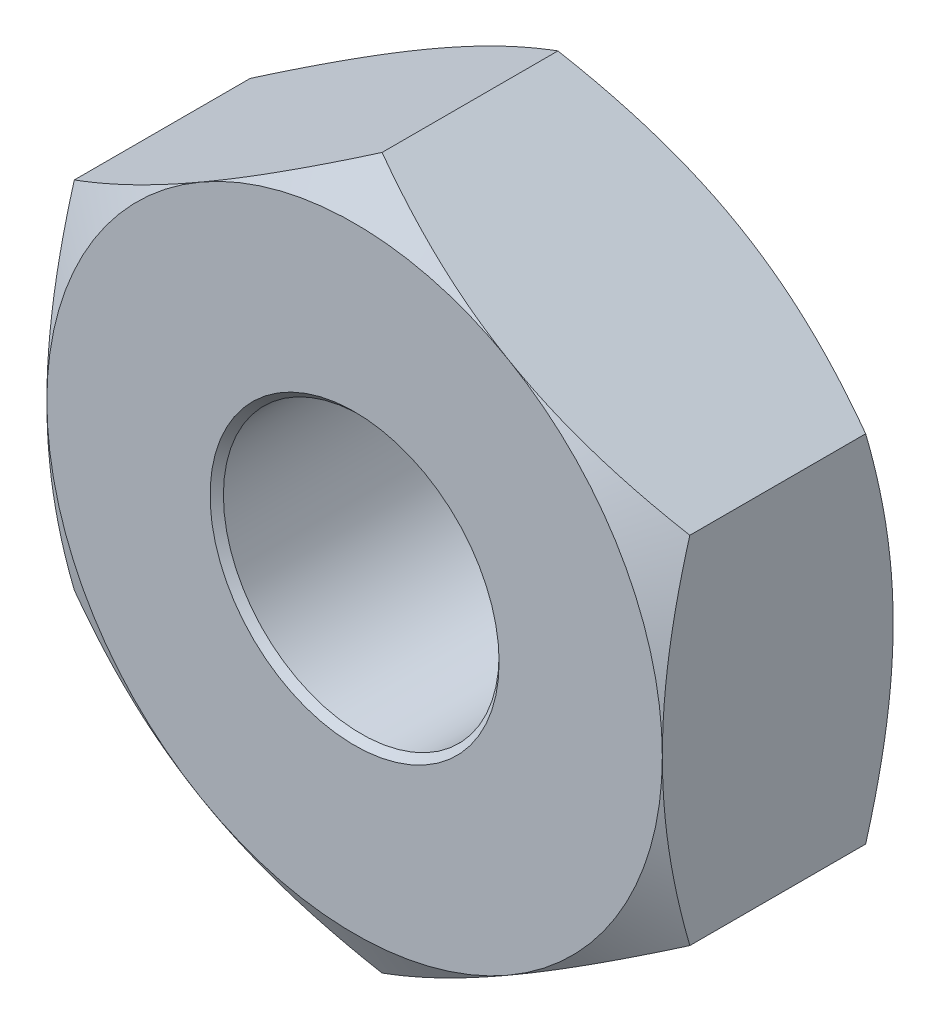
from build123d import *

# Parameters (mm, degrees)
BOSS_EXTRUDE1_START = -1.190625
SKETCH3_R           = 1.4224
BOSS_EXTRUDE1_DEPTH = 2.38125


# Read off the part's stored shape, not the designer's step: Cut-Revolve1
with BuildPart() as part:
    # Sketch3 → Boss-Extrude1 (new body)
    with BuildSketch(Plane.XY.offset(BOSS_EXTRUDE1_START)):
        Polygon((-3.175, 1.833087105), (-3.175, -1.833087105), (0, -3.666174209), (3.175, -1.833087105), (3.175, 1.833087105), (0, 3.666174209), align=None)
        with Locations(Location((0, 0, 0), (0, 0, 180))):
            Circle(SKETCH3_R, mode=Mode.SUBTRACT)
    extrude(amount=BOSS_EXTRUDE1_DEPTH)

    # Cut-Revolve1 outline → Cut-Revolve1 (revolve, cut)
    with BuildSketch(Plane.XZ):
        Polygon((3.66617421, -0.907045438), (3.174999964, -1.190625021), (3.666174217, -1.190625256), align=None)
        Polygon((3.175, 1.190625), (3.66617421, 0.907045438), (3.666174217, 1.190625256), align=None)
    revolve(axis=Axis((0, 0, 0), (0, 0, 1)), mode=Mode.SUBTRACT)

    # Sketch9 → Cut-Revolve2 (revolve, cut)
    with BuildSketch(Plane(origin=(0, 0, 0), x_dir=(0, 0, -1), z_dir=(1, 0, 0)), mode=Mode.PRIVATE) as cut_revolve2_sk:
        Polygon((-1.121884234, 1.4224), (-1.7859375, 2.086453266), (-1.7859375, 1.4224), (-1.7859375, 0), (-1.121884234, 0), (-0.640698869, 0), (-0.640698869, 0.941214635), align=None)
        Polygon((1.7859375, 2.086453266), (1.7859375, 1.4224), (1.7859375, 0), (1.121884234, 0), (0.640698869, 0), (0.640698869, 0.941214635), (1.121884234, 1.4224), align=None)
    revolve(cut_revolve2_sk.sketch.rotate(Axis((0, 0, 1.190625), (0, 0, -1)), 270), axis=Axis((0, 0, 1.190625), (0, 0, -1)), mode=Mode.SUBTRACT)


solid = part.part
